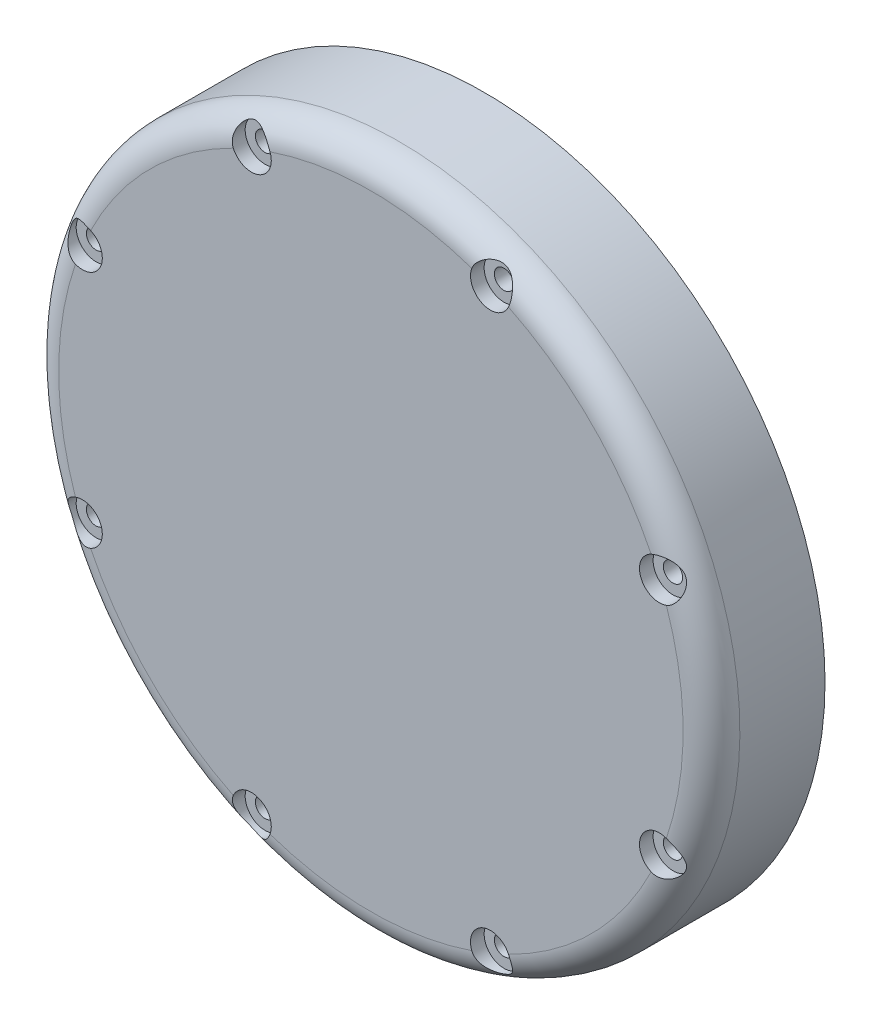
from build123d import *

# Parameters (mm, degrees)
SALIENTE_EXTRUIR1_DEPTH                              = 15
CROQUIS2_R                                           = 60
SALIENTE_EXTRUIR2_DEPTH                              = 5
REFRENTADO_PARA_TORNILLO_CON_CABEZA_TRON_D           = 3.4
REFRENTADO_PARA_TORNILLO_CON_CABEZA_TRON_CBORE_D     = 7
REFRENTADO_PARA_TORNILLO_CON_CABEZA_TRON_CBORE_DEPTH = 2.4
REDONDEO1_R                                          = 5


with BuildPart() as part:
    # Croquis1 → Saliente-Extruir1 (new body)
    with BuildSketch(Plane.XY):
        with BuildLine():
            Line((-15, -49.849774322), (-15, -54.083269132))
            ThreePointArc((-15, -54.083269132), (-16.245307044, -56.516590449), (-18.947368421, -56.929756981))
            ThreePointArc((-18.947368421, -56.929756981), (0, 60), (18.947368421, -56.929756981))
            ThreePointArc((18.947368421, -56.929756981), (16.245307044, -56.516590449), (15, -54.083269132))
            Line((15, -54.083269132), (15, -49.849774322))
            ThreePointArc((15, -49.849774322), (15.544739955, -48.125912926), (16.981132075, -47.028088983))
            ThreePointArc((16.981132075, -47.028088983), (0, 50), (-16.981132075, -47.028088983))
            ThreePointArc((-16.981132075, -47.028088983), (-15.544739955, -48.125912926), (-15, -49.849774322))
        make_face()
    extrude(amount=SALIENTE_EXTRUIR1_DEPTH)

    # Croquis2 → Saliente-Extruir2 (add)
    with BuildSketch(Plane.XY.offset(15)):
        with Locations(Location((0, 0, 0), (0, 0, 251.591519829))):
            Circle(CROQUIS2_R)
    extrude(amount=SALIENTE_EXTRUIR2_DEPTH)

    # Refrentado para tornillo con cabeza troncocónica de M31 (through all)
    with Locations(Plane.XY.offset(20)):
        with Locations((-21.04758878, 50.813374288), (21.04758878, 50.813374288), (50.813374288, 21.04758878), (50.813374288, -21.04758878), (21.04758878, -50.813374288), (-21.04758878, -50.813374288), (-50.813374288, -21.04758878), (-50.813374288, 21.04758878)):
            CounterBoreHole(REFRENTADO_PARA_TORNILLO_CON_CABEZA_TRON_D / 2, REFRENTADO_PARA_TORNILLO_CON_CABEZA_TRON_CBORE_D / 2, REFRENTADO_PARA_TORNILLO_CON_CABEZA_TRON_CBORE_DEPTH)

    # Redondeo1
    # the kernel refuses this fillet: 5 mm, written as the material it takes off along each edge
    with BuildSketch(Plane(origin=(0, 0, 20), x_dir=(-0.31578947369106963, -0.9488292830145564, 0), z_dir=(-0.9488292830145564, 0.31578947369106963, 0))) as redondeo1_piece_1:
        with BuildLine():
            CenterArc((60 - REDONDEO1_R, -REDONDEO1_R), REDONDEO1_R, 0, 90)
            Line((60 - REDONDEO1_R, 0), (60, 0))
            Line((60, 0), (60, -REDONDEO1_R))
        make_face()
    revolve(axis=Axis((0, 0, 20), (0, 0, 1)), mode=Mode.SUBTRACT)


solid = part.part
